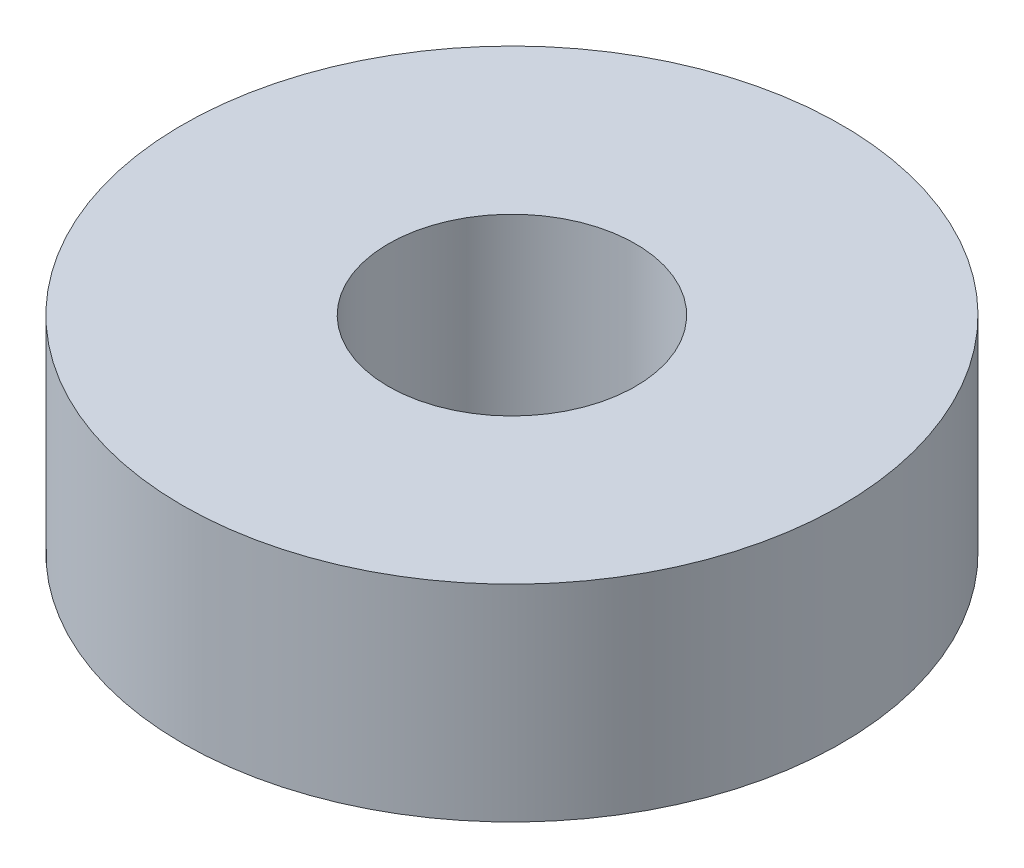
from build123d import *

# Parameters (mm, degrees)
SKETCH1_R           = 8
SKETCH1_R_2         = 3
BOSS_EXTRUDE1_DEPTH = 5


with BuildPart() as part:
    # Sketch1 → Boss-Extrude1 (new body)
    with BuildSketch(Plane(origin=(0, 0, 0), x_dir=(1, 0, 0), z_dir=(0, 1, 0))):
        Circle(SKETCH1_R)
        Circle(SKETCH1_R_2, mode=Mode.SUBTRACT)
    extrude(amount=BOSS_EXTRUDE1_DEPTH)


solid = part.part
